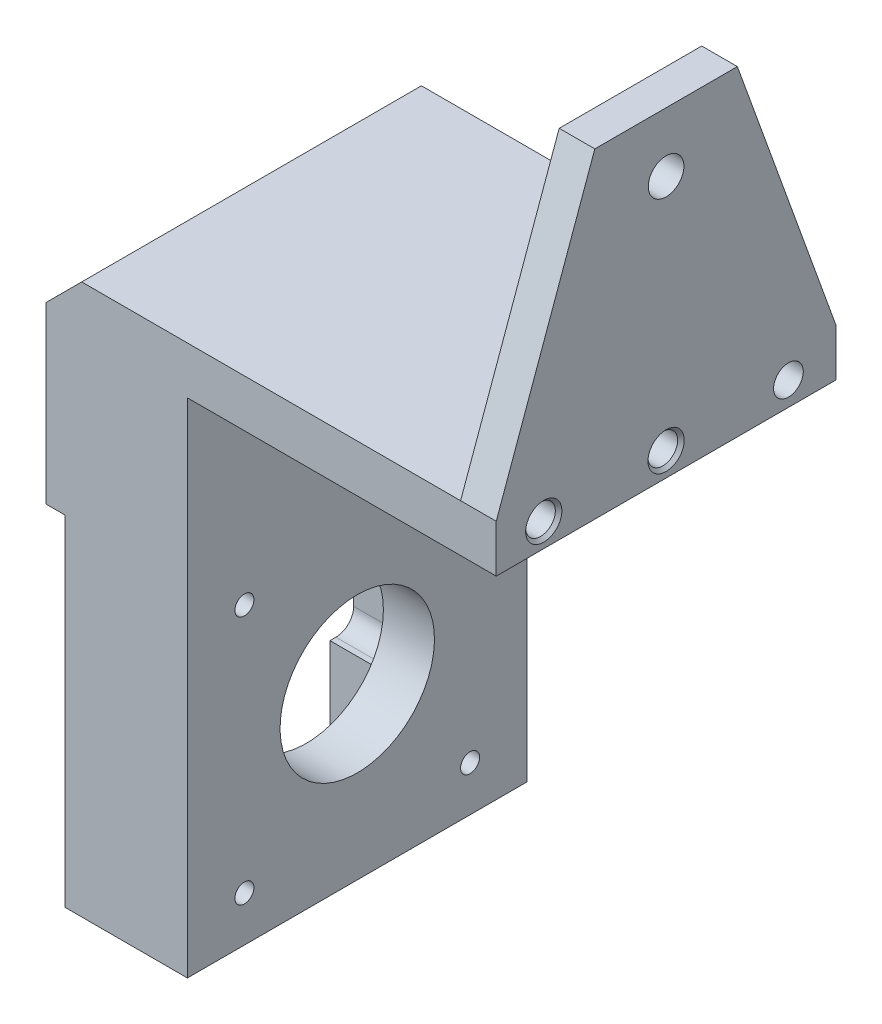
from build123d import *

# Parameters (mm, degrees)
EXTRUDE_1_DEPTH     = 28.6
SKETCH_1_R          = 6.5
CUT_EXTRUDE_1_DEPTH = 70.103002637
SKETCH_2_R          = 0.8
CUT_EXTRUDE_2_DEPTH = 70.103002637
CUT_EXTRUDE_4_DEPTH = 6
EXTRUDE_2_DEPTH     = 1.6
FILLET_1_R          = 1.5
FILLET_2_R          = 1.5
SKETCH_6_R          = 1.5
SKETCH_6_R_2        = 1.25
CUT_EXTRUDE_7_DEPTH = 8
CUT_EXTRUDE_8_DEPTH = 8


with BuildPart() as part:
    # Model → 凸台-拉伸1 (new body)
    with BuildSketch(Plane.XY):
        Polygon((-24.978787879, -17.92321671), (-14.678787879, -17.92321671), (-14.678787879, 24.376794113), (11.321212121, 24.376794113), (11.321212121, 51.376794114), (8.321212121, 51.376794114), (8.321212121, 28.376794114), (-23.578787879, 28.376794114), (-26.578787879, 25.376794114), (-26.578787879, 24.376794113), (-24.978787879, 24.376794113), align=None)
    extrude(amount=EXTRUDE_1_DEPTH)

    # 草图1 → 切除-拉伸1 (cut, through all)
    with BuildSketch(Plane.ZY.offset(24.978787879)):
        with Locations((14.3, -3.623205886)):
            Circle(SKETCH_1_R)
    extrude(amount=-CUT_EXTRUDE_1_DEPTH, mode=Mode.SUBTRACT)

    # 草图2 → 切除-拉伸2 (cut, through all)
    with BuildSketch(Plane.ZY.offset(24.978787879)):
        with Locations((23.8, 6.876794114)):
            Circle(SKETCH_2_R)
        with Locations((23.8, -14.123205886)):
            Circle(SKETCH_2_R)
        with Locations((4.8, -14.123205886)):
            Circle(SKETCH_2_R)
        with Locations((4.8, 6.876794114)):
            Circle(SKETCH_2_R)
    extrude(amount=-CUT_EXTRUDE_2_DEPTH, mode=Mode.SUBTRACT)

    # 草图3 → 切除-拉伸4 (cut)
    with BuildSketch(Plane.ZY.offset(24.978787879)):
        Polygon((6.3, -35.623205886), (22.3, -35.623205886), (22.3, -9.623205886), (24.3, -9.623205886), (24.3, 2.376794114), (22.3, 2.376794114), (22.3, 14.376794114), (6.3, 14.376794114), (6.3, 2.376794114), (4.3, 2.376794114), (4.3, -9.623205886), (6.3, -9.623205886), align=None)
    extrude(amount=-CUT_EXTRUDE_4_DEPTH, mode=Mode.SUBTRACT)

    # 草图5 → 凸台-拉伸2 (add, through all)
    with BuildSketch(Plane.ZY.offset(24.978787879)):
        Polygon((0, 24.376794113), (28.6, 24.376794113), (28.6, 10.676804938), (22.3, 10.676804938), (22.3, 14.376794114), (6.3, 14.376794114), (6.3, 10.676804938), (0, 10.676804938), align=None)
    extrude(amount=EXTRUDE_2_DEPTH)

    # 圆角1
    fillet_1_edges = [part.edges().sort_by_distance(p)[0] for p in [
        (-21.978787879, -9.623205886, 4.3),
        (-21.978787879, 2.376794114, 4.3),
        (-21.978787879, 2.376794114, 24.3),
        (-21.978787879, -9.623205886, 24.3),
    ]]
    fillet(fillet_1_edges, radius=FILLET_1_R)

    # 圆角2
    fillet_2_edges = [part.edges().sort_by_distance(p)[0] for p in [
        (-22.778787879, 14.376794114, 6.3),
        (-22.778787879, 14.376794114, 22.3),
    ]]
    fillet(fillet_2_edges, radius=FILLET_2_R)

    # 草图6 → 切除-拉伸7 (cut)
    with BuildSketch(Plane(origin=(11.321212121, 0, 0), x_dir=(0, 0, -1), z_dir=(1, 0, 0))):
        with Locations((-14.3, 46.376794114)):
            Circle(SKETCH_6_R)
        with Locations((-14.3, 26.376794113)):
            Circle(SKETCH_6_R_2)
        with Locations((-24.6, 26.376794113)):
            Circle(SKETCH_6_R_2)
        with Locations(Location((-4, 26.376794113, 0), (0, 0, 180))):
            Circle(SKETCH_6_R_2)
    extrude(amount=-CUT_EXTRUDE_7_DEPTH, mode=Mode.SUBTRACT)

    # 草图8 → 切除-拉伸8 (cut)
    with BuildSketch(Plane.ZY.offset(-8.321212121)):
        Polygon((8.3, 51.376794114), (0, 28.376794114), (-7.058670234, 55.306274643), align=None)
        Polygon((28.6, 28.376794114), (35.658670234, 55.306274643), (20.3, 51.376794114), align=None)
    extrude(amount=-CUT_EXTRUDE_8_DEPTH, mode=Mode.SUBTRACT)

    # M3 螺纹孔1: read off the stored shape, not the designer's step
    # M3 螺纹孔1 outline → M3 螺纹孔1 (revolve, cut)
    with BuildSketch(Plane(origin=(0, 26.376794113, 4), x_dir=(0, 1, 0), z_dir=(0, 0, -1))):
        Polygon((0, -7.429863653), (1.25, -6.678787879), (1.25, 3.046212121), (1.525, 3.321212121), (0, 3.321212121), align=None)
    revolve(axis=Axis((0, 26.376794113, 4), (1, 0, 0)), mode=Mode.SUBTRACT)

    # Hole Wizard M3 _1 2 outline → Hole Wizard M3 _1 2 (revolve, cut)
    with BuildSketch(Plane(origin=(0, 26.376794113, 14.3), x_dir=(0, 1, 0), z_dir=(0, 0, -1))):
        Polygon((1.25, 11.321212121), (1.25, 11.046212121), (1.525, 11.321212121), align=None)
        Polygon((1.25, 1.321212121), (1.25, 11.046212121), (0, 11.046212121), (0, 0.570136347), align=None)
    revolve(axis=Axis((0, 26.376794113, 14.3), (1, 0, 0)), mode=Mode.SUBTRACT)

    # Hole Wizard M3 _1 3 outline → Hole Wizard M3 _1 3 (revolve, cut)
    with BuildSketch(Plane(origin=(0, 26.376794113, 24.6), x_dir=(0, 1, 0), z_dir=(0, 0, -1))):
        Polygon((1.25, 11.321212121), (1.25, 11.046212121), (1.525, 11.321212121), align=None)
        Polygon((1.25, 1.321212121), (1.25, 3.321212121), (0, 3.321212121), (0, 0.570136347), align=None)
    revolve(axis=Axis((0, 26.376794113, 24.6), (1, 0, 0)), mode=Mode.SUBTRACT)


solid = part.part
